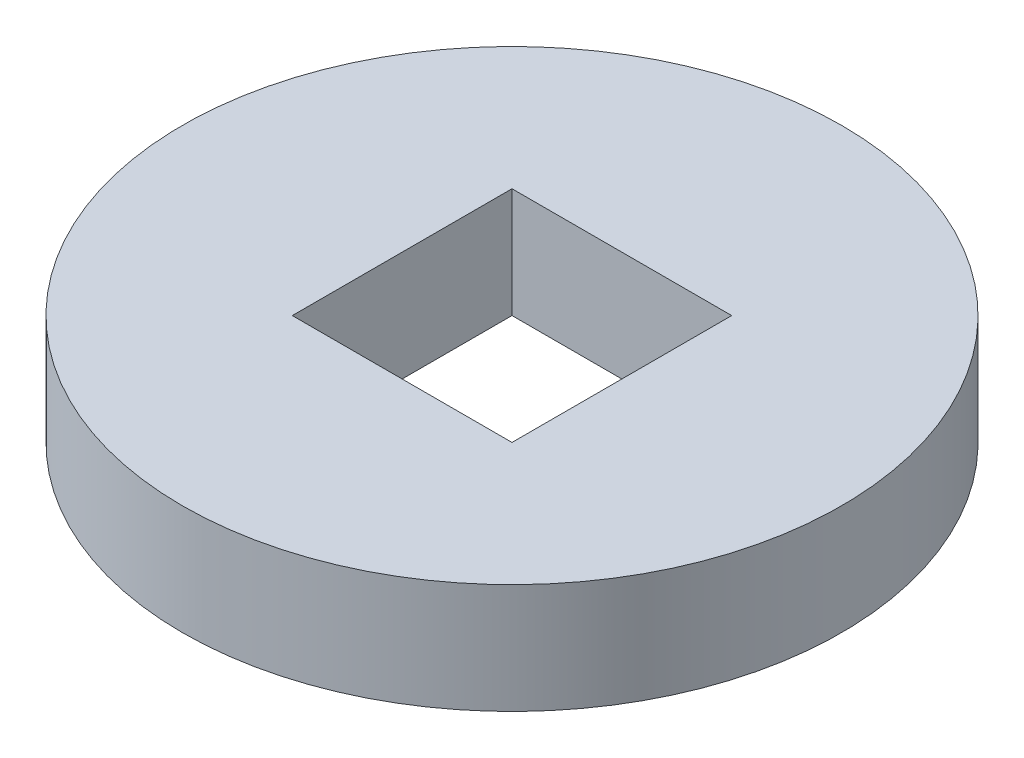
from build123d import *

# Parameters (mm, degrees)
SKETCH1_R           = 15
SKETCH1_W           = 10
SKETCH1_H           = 10
BOSS_EXTRUDE1_DEPTH = 5


with BuildPart() as part:
    # Sketch1 → Boss-Extrude1 (new body)
    with BuildSketch(Plane(origin=(0, 0, 0), x_dir=(1, 0, 0), z_dir=(0, 1, 0))):
        Circle(SKETCH1_R)
        Rectangle(SKETCH1_W, SKETCH1_H, mode=Mode.SUBTRACT)
    extrude(amount=BOSS_EXTRUDE1_DEPTH)


solid = part.part
